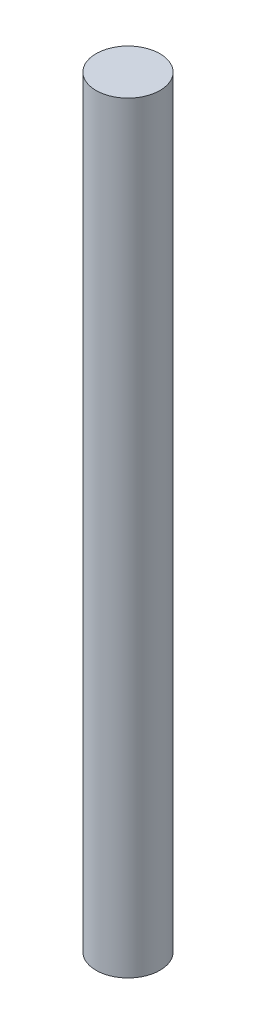
from build123d import *

# Parameters (mm, degrees)
SKETCH1_R           = 1.905
BOSS_EXTRUDE1_DEPTH = 45.466


with BuildPart() as part:
    # Sketch1 → Boss-Extrude1 (new body)
    with BuildSketch(Plane(origin=(0, 0, 0), x_dir=(1, 0, 0), z_dir=(0, 1, 0))):
        Circle(SKETCH1_R)
    extrude(amount=BOSS_EXTRUDE1_DEPTH)


solid = part.part
